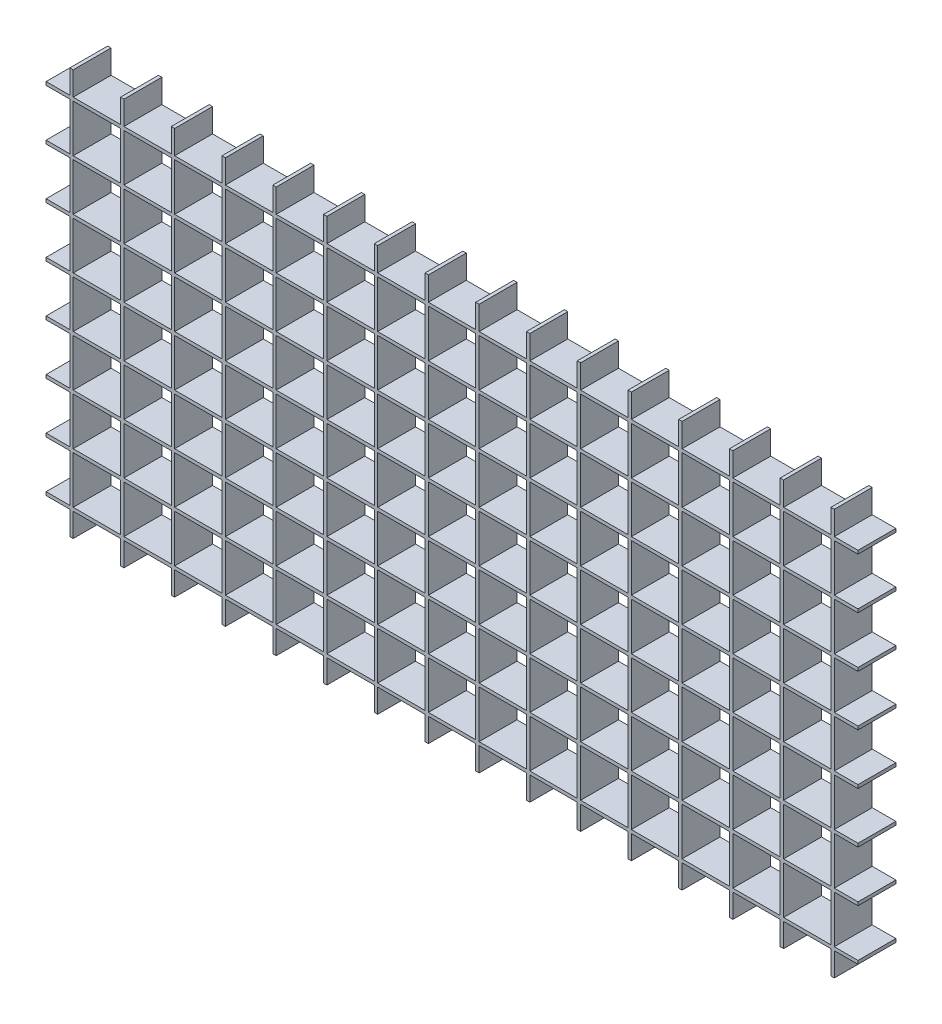
from build123d import *

# Parameters (mm, degrees)
SKETCH1_W           = 600
SKETCH1_H           = 300
BOSS_EXTRUDE1_DEPTH = 28
SKETCH2_W           = 35
SKETCH2_H           = 35
CUT_EXTRUDE1_DEPTH  = 28


with BuildPart() as part:
    # Sketch1 → Boss-Extrude1 (new body)
    with BuildSketch(Plane.XY):
        with Locations((-300, 19.565217391)):
            Rectangle(SKETCH1_W, SKETCH1_H)
    extrude(amount=BOSS_EXTRUDE1_DEPTH)

    # Sketch2 → Cut-Extrude1 (cut)
    with BuildSketch(Plane.XY.offset(28)):
        with Locations((-37.5, 169.565217391)):
            Rectangle(SKETCH2_W, SKETCH2_H)
        with Locations((0, 169.565217391)):
            Rectangle(SKETCH2_W, SKETCH2_H)
        with Locations((-75, 169.565217391)):
            Rectangle(SKETCH2_W, SKETCH2_H)
        with Locations((-112.5, 169.565217391)):
            Rectangle(SKETCH2_W, SKETCH2_H)
        with Locations((-150, 169.565217391)):
            Rectangle(SKETCH2_W, SKETCH2_H)
        with Locations((-187.5, 169.565217391)):
            Rectangle(SKETCH2_W, SKETCH2_H)
        with Locations((-225, 169.565217391)):
            Rectangle(SKETCH2_W, SKETCH2_H)
        with Locations((-262.5, 169.565217391)):
            Rectangle(SKETCH2_W, SKETCH2_H)
        with Locations((-300, 169.565217391)):
            Rectangle(SKETCH2_W, SKETCH2_H)
        with Locations((-337.5, 169.565217391)):
            Rectangle(SKETCH2_W, SKETCH2_H)
        with Locations((-375, 169.565217391)):
            Rectangle(SKETCH2_W, SKETCH2_H)
        with Locations((-412.5, 169.565217391)):
            Rectangle(SKETCH2_W, SKETCH2_H)
        with Locations((-450, 169.565217391)):
            Rectangle(SKETCH2_W, SKETCH2_H)
        with Locations((-487.5, 169.565217391)):
            Rectangle(SKETCH2_W, SKETCH2_H)
        with Locations((-525, 169.565217391)):
            Rectangle(SKETCH2_W, SKETCH2_H)
        with Locations((-562.5, 169.565217391)):
            Rectangle(SKETCH2_W, SKETCH2_H)
        with Locations((-600, 169.565217391)):
            Rectangle(SKETCH2_W, SKETCH2_H)
        with Locations((-37.5, 132.065217391)):
            Rectangle(SKETCH2_W, SKETCH2_H)
        with Locations((-75, 132.065217391)):
            Rectangle(SKETCH2_W, SKETCH2_H)
        with Locations((-112.5, 132.065217391)):
            Rectangle(SKETCH2_W, SKETCH2_H)
        with Locations((-150, 132.065217391)):
            Rectangle(SKETCH2_W, SKETCH2_H)
        with Locations((-187.5, 132.065217391)):
            Rectangle(SKETCH2_W, SKETCH2_H)
        with Locations((-225, 132.065217391)):
            Rectangle(SKETCH2_W, SKETCH2_H)
        with Locations((-262.5, 132.065217391)):
            Rectangle(SKETCH2_W, SKETCH2_H)
        with Locations((-300, 132.065217391)):
            Rectangle(SKETCH2_W, SKETCH2_H)
        with Locations((-337.5, 132.065217391)):
            Rectangle(SKETCH2_W, SKETCH2_H)
        with Locations((-375, 132.065217391)):
            Rectangle(SKETCH2_W, SKETCH2_H)
        with Locations((-412.5, 132.065217391)):
            Rectangle(SKETCH2_W, SKETCH2_H)
        with Locations((-450, 132.065217391)):
            Rectangle(SKETCH2_W, SKETCH2_H)
        with Locations((-487.5, 132.065217391)):
            Rectangle(SKETCH2_W, SKETCH2_H)
        with Locations((-525, 132.065217391)):
            Rectangle(SKETCH2_W, SKETCH2_H)
        with Locations((-562.5, 132.065217391)):
            Rectangle(SKETCH2_W, SKETCH2_H)
        with Locations((-600, 132.065217391)):
            Rectangle(SKETCH2_W, SKETCH2_H)
        with Locations((-37.5, 94.565217391)):
            Rectangle(SKETCH2_W, SKETCH2_H)
        with Locations((-75, 94.565217391)):
            Rectangle(SKETCH2_W, SKETCH2_H)
        with Locations((-112.5, 94.565217391)):
            Rectangle(SKETCH2_W, SKETCH2_H)
        with Locations((-150, 94.565217391)):
            Rectangle(SKETCH2_W, SKETCH2_H)
        with Locations((-187.5, 94.565217391)):
            Rectangle(SKETCH2_W, SKETCH2_H)
        with Locations((-225, 94.565217391)):
            Rectangle(SKETCH2_W, SKETCH2_H)
        with Locations((-262.5, 94.565217391)):
            Rectangle(SKETCH2_W, SKETCH2_H)
        with Locations((-300, 94.565217391)):
            Rectangle(SKETCH2_W, SKETCH2_H)
        with Locations((-337.5, 94.565217391)):
            Rectangle(SKETCH2_W, SKETCH2_H)
        with Locations((-375, 94.565217391)):
            Rectangle(SKETCH2_W, SKETCH2_H)
        with Locations((-412.5, 94.565217391)):
            Rectangle(SKETCH2_W, SKETCH2_H)
        with Locations((-450, 94.565217391)):
            Rectangle(SKETCH2_W, SKETCH2_H)
        with Locations((-487.5, 94.565217391)):
            Rectangle(SKETCH2_W, SKETCH2_H)
        with Locations((-525, 94.565217391)):
            Rectangle(SKETCH2_W, SKETCH2_H)
        with Locations((-562.5, 94.565217391)):
            Rectangle(SKETCH2_W, SKETCH2_H)
        with Locations((-600, 94.565217391)):
            Rectangle(SKETCH2_W, SKETCH2_H)
        with Locations((-37.5, 57.065217391)):
            Rectangle(SKETCH2_W, SKETCH2_H)
        with Locations((-75, 57.065217391)):
            Rectangle(SKETCH2_W, SKETCH2_H)
        with Locations((-112.5, 57.065217391)):
            Rectangle(SKETCH2_W, SKETCH2_H)
        with Locations((-150, 57.065217391)):
            Rectangle(SKETCH2_W, SKETCH2_H)
        with Locations((-187.5, 57.065217391)):
            Rectangle(SKETCH2_W, SKETCH2_H)
        with Locations((-225, 57.065217391)):
            Rectangle(SKETCH2_W, SKETCH2_H)
        with Locations((-262.5, 57.065217391)):
            Rectangle(SKETCH2_W, SKETCH2_H)
        with Locations((-300, 57.065217391)):
            Rectangle(SKETCH2_W, SKETCH2_H)
        with Locations((-337.5, 57.065217391)):
            Rectangle(SKETCH2_W, SKETCH2_H)
        with Locations((-375, 57.065217391)):
            Rectangle(SKETCH2_W, SKETCH2_H)
        with Locations((-412.5, 57.065217391)):
            Rectangle(SKETCH2_W, SKETCH2_H)
        with Locations((-450, 57.065217391)):
            Rectangle(SKETCH2_W, SKETCH2_H)
        with Locations((-487.5, 57.065217391)):
            Rectangle(SKETCH2_W, SKETCH2_H)
        with Locations((-525, 57.065217391)):
            Rectangle(SKETCH2_W, SKETCH2_H)
        with Locations((-562.5, 57.065217391)):
            Rectangle(SKETCH2_W, SKETCH2_H)
        with Locations((-600, 57.065217391)):
            Rectangle(SKETCH2_W, SKETCH2_H)
        with Locations((-37.5, 19.565217391)):
            Rectangle(SKETCH2_W, SKETCH2_H)
        with Locations((-75, 19.565217391)):
            Rectangle(SKETCH2_W, SKETCH2_H)
        with Locations((-112.5, 19.565217391)):
            Rectangle(SKETCH2_W, SKETCH2_H)
        with Locations((-150, 19.565217391)):
            Rectangle(SKETCH2_W, SKETCH2_H)
        with Locations((-187.5, 19.565217391)):
            Rectangle(SKETCH2_W, SKETCH2_H)
        with Locations((-225, 19.565217391)):
            Rectangle(SKETCH2_W, SKETCH2_H)
        with Locations((-262.5, 19.565217391)):
            Rectangle(SKETCH2_W, SKETCH2_H)
        with Locations((-300, 19.565217391)):
            Rectangle(SKETCH2_W, SKETCH2_H)
        with Locations((-337.5, 19.565217391)):
            Rectangle(SKETCH2_W, SKETCH2_H)
        with Locations((-375, 19.565217391)):
            Rectangle(SKETCH2_W, SKETCH2_H)
        with Locations((-412.5, 19.565217391)):
            Rectangle(SKETCH2_W, SKETCH2_H)
        with Locations((-450, 19.565217391)):
            Rectangle(SKETCH2_W, SKETCH2_H)
        with Locations((-487.5, 19.565217391)):
            Rectangle(SKETCH2_W, SKETCH2_H)
        with Locations((-525, 19.565217391)):
            Rectangle(SKETCH2_W, SKETCH2_H)
        with Locations((-562.5, 19.565217391)):
            Rectangle(SKETCH2_W, SKETCH2_H)
        with Locations((-600, 19.565217391)):
            Rectangle(SKETCH2_W, SKETCH2_H)
        with Locations((-37.5, -17.934782609)):
            Rectangle(SKETCH2_W, SKETCH2_H)
        with Locations((-75, -17.934782609)):
            Rectangle(SKETCH2_W, SKETCH2_H)
        with Locations((-112.5, -17.934782609)):
            Rectangle(SKETCH2_W, SKETCH2_H)
        with Locations((-150, -17.934782609)):
            Rectangle(SKETCH2_W, SKETCH2_H)
        with Locations((-187.5, -17.934782609)):
            Rectangle(SKETCH2_W, SKETCH2_H)
        with Locations((-225, -17.934782609)):
            Rectangle(SKETCH2_W, SKETCH2_H)
        with Locations((-262.5, -17.934782609)):
            Rectangle(SKETCH2_W, SKETCH2_H)
        with Locations((-300, -17.934782609)):
            Rectangle(SKETCH2_W, SKETCH2_H)
        with Locations((-337.5, -17.934782609)):
            Rectangle(SKETCH2_W, SKETCH2_H)
        with Locations((-375, -17.934782609)):
            Rectangle(SKETCH2_W, SKETCH2_H)
        with Locations((-412.5, -17.934782609)):
            Rectangle(SKETCH2_W, SKETCH2_H)
        with Locations((-450, -17.934782609)):
            Rectangle(SKETCH2_W, SKETCH2_H)
        with Locations((-487.5, -17.934782609)):
            Rectangle(SKETCH2_W, SKETCH2_H)
        with Locations((-525, -17.934782609)):
            Rectangle(SKETCH2_W, SKETCH2_H)
        with Locations((-562.5, -17.934782609)):
            Rectangle(SKETCH2_W, SKETCH2_H)
        with Locations((-600, -17.934782609)):
            Rectangle(SKETCH2_W, SKETCH2_H)
        with Locations((-37.5, -55.434782609)):
            Rectangle(SKETCH2_W, SKETCH2_H)
        with Locations((-75, -55.434782609)):
            Rectangle(SKETCH2_W, SKETCH2_H)
        with Locations((-112.5, -55.434782609)):
            Rectangle(SKETCH2_W, SKETCH2_H)
        with Locations((-150, -55.434782609)):
            Rectangle(SKETCH2_W, SKETCH2_H)
        with Locations((-187.5, -55.434782609)):
            Rectangle(SKETCH2_W, SKETCH2_H)
        with Locations((-225, -55.434782609)):
            Rectangle(SKETCH2_W, SKETCH2_H)
        with Locations((-262.5, -55.434782609)):
            Rectangle(SKETCH2_W, SKETCH2_H)
        with Locations((-300, -55.434782609)):
            Rectangle(SKETCH2_W, SKETCH2_H)
        with Locations((-337.5, -55.434782609)):
            Rectangle(SKETCH2_W, SKETCH2_H)
        with Locations((-375, -55.434782609)):
            Rectangle(SKETCH2_W, SKETCH2_H)
        with Locations((-412.5, -55.434782609)):
            Rectangle(SKETCH2_W, SKETCH2_H)
        with Locations((-450, -55.434782609)):
            Rectangle(SKETCH2_W, SKETCH2_H)
        with Locations((-487.5, -55.434782609)):
            Rectangle(SKETCH2_W, SKETCH2_H)
        with Locations((-525, -55.434782609)):
            Rectangle(SKETCH2_W, SKETCH2_H)
        with Locations((-562.5, -55.434782609)):
            Rectangle(SKETCH2_W, SKETCH2_H)
        with Locations((-600, -55.434782609)):
            Rectangle(SKETCH2_W, SKETCH2_H)
        with Locations((-37.5, -92.934782609)):
            Rectangle(SKETCH2_W, SKETCH2_H)
        with Locations((-75, -92.934782609)):
            Rectangle(SKETCH2_W, SKETCH2_H)
        with Locations((-112.5, -92.934782609)):
            Rectangle(SKETCH2_W, SKETCH2_H)
        with Locations((-150, -92.934782609)):
            Rectangle(SKETCH2_W, SKETCH2_H)
        with Locations((-187.5, -92.934782609)):
            Rectangle(SKETCH2_W, SKETCH2_H)
        with Locations((-225, -92.934782609)):
            Rectangle(SKETCH2_W, SKETCH2_H)
        with Locations((-262.5, -92.934782609)):
            Rectangle(SKETCH2_W, SKETCH2_H)
        with Locations((-300, -92.934782609)):
            Rectangle(SKETCH2_W, SKETCH2_H)
        with Locations((-337.5, -92.934782609)):
            Rectangle(SKETCH2_W, SKETCH2_H)
        with Locations((-375, -92.934782609)):
            Rectangle(SKETCH2_W, SKETCH2_H)
        with Locations((-412.5, -92.934782609)):
            Rectangle(SKETCH2_W, SKETCH2_H)
        with Locations((-450, -92.934782609)):
            Rectangle(SKETCH2_W, SKETCH2_H)
        with Locations((-487.5, -92.934782609)):
            Rectangle(SKETCH2_W, SKETCH2_H)
        with Locations((-525, -92.934782609)):
            Rectangle(SKETCH2_W, SKETCH2_H)
        with Locations((-562.5, -92.934782609)):
            Rectangle(SKETCH2_W, SKETCH2_H)
        with Locations((-600, -92.934782609)):
            Rectangle(SKETCH2_W, SKETCH2_H)
        with Locations((-37.5, -130.434782609)):
            Rectangle(SKETCH2_W, SKETCH2_H)
        with Locations((-75, -130.434782609)):
            Rectangle(SKETCH2_W, SKETCH2_H)
        with Locations((-112.5, -130.434782609)):
            Rectangle(SKETCH2_W, SKETCH2_H)
        with Locations((-150, -130.434782609)):
            Rectangle(SKETCH2_W, SKETCH2_H)
        with Locations((-187.5, -130.434782609)):
            Rectangle(SKETCH2_W, SKETCH2_H)
        with Locations((-225, -130.434782609)):
            Rectangle(SKETCH2_W, SKETCH2_H)
        with Locations((-262.5, -130.434782609)):
            Rectangle(SKETCH2_W, SKETCH2_H)
        with Locations((-300, -130.434782609)):
            Rectangle(SKETCH2_W, SKETCH2_H)
        with Locations((-337.5, -130.434782609)):
            Rectangle(SKETCH2_W, SKETCH2_H)
        with Locations((-375, -130.434782609)):
            Rectangle(SKETCH2_W, SKETCH2_H)
        with Locations((-412.5, -130.434782609)):
            Rectangle(SKETCH2_W, SKETCH2_H)
        with Locations((-450, -130.434782609)):
            Rectangle(SKETCH2_W, SKETCH2_H)
        with Locations((-487.5, -130.434782609)):
            Rectangle(SKETCH2_W, SKETCH2_H)
        with Locations((-525, -130.434782609)):
            Rectangle(SKETCH2_W, SKETCH2_H)
        with Locations((-562.5, -130.434782609)):
            Rectangle(SKETCH2_W, SKETCH2_H)
        with Locations((-600, -130.434782609)):
            Rectangle(SKETCH2_W, SKETCH2_H)
        with Locations((0, 132.065217391)):
            Rectangle(SKETCH2_W, SKETCH2_H)
        with Locations((0, 94.565217391)):
            Rectangle(SKETCH2_W, SKETCH2_H)
        with Locations((0, 57.065217391)):
            Rectangle(SKETCH2_W, SKETCH2_H)
        with Locations((0, 19.565217391)):
            Rectangle(SKETCH2_W, SKETCH2_H)
        with Locations((0, -17.934782609)):
            Rectangle(SKETCH2_W, SKETCH2_H)
        with Locations((0, -55.434782609)):
            Rectangle(SKETCH2_W, SKETCH2_H)
        with Locations((0, -92.934782609)):
            Rectangle(SKETCH2_W, SKETCH2_H)
        with Locations((0, -130.434782609)):
            Rectangle(SKETCH2_W, SKETCH2_H)
    extrude(amount=-CUT_EXTRUDE1_DEPTH, mode=Mode.SUBTRACT)


solid = part.part
